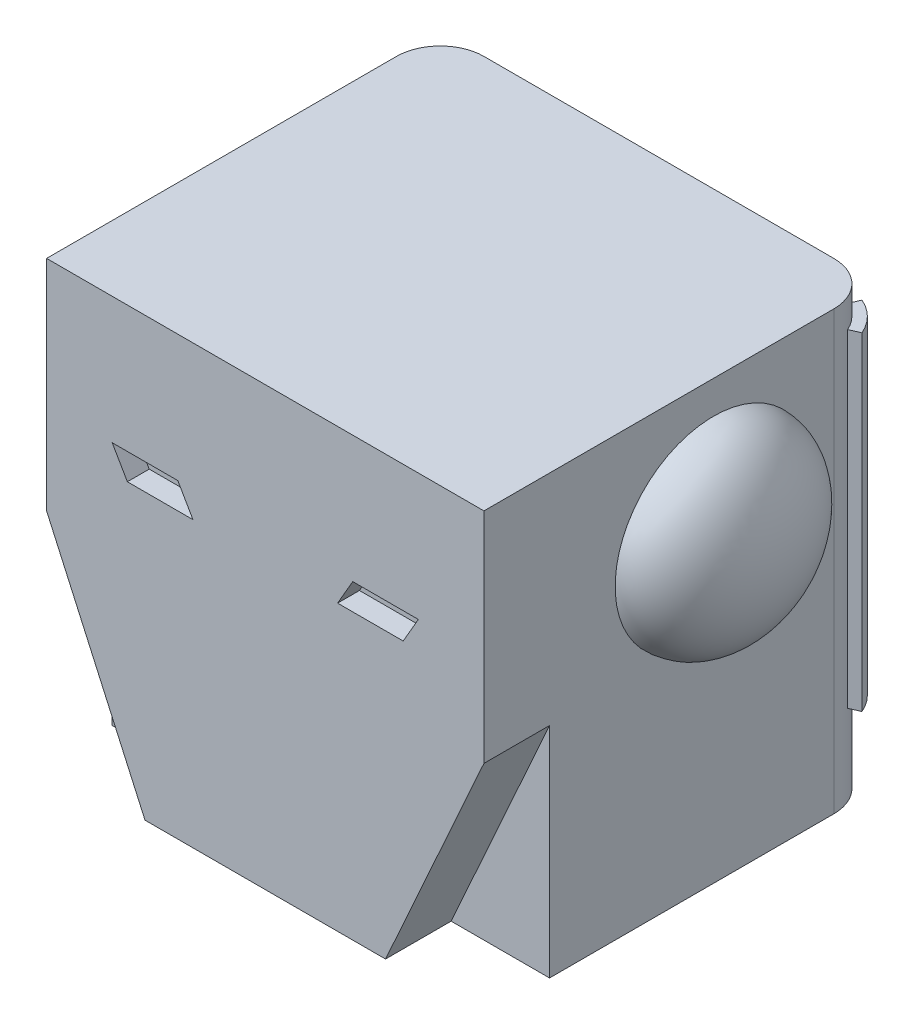
from build123d import *

# Parameters (mm, degrees)
SKETCH1_W           = 20
SKETCH1_H           = 15
BOSS_EXTRUDE1_DEPTH = 20
SKETCH2_R           = 4.5
CUT_EXTRUDE1_DEPTH  = 7
BOSS_EXTRUDE2_DEPTH = 3
CUT_EXTRUDE4_DEPTH  = 1
FILLET1_R           = 2
WRAP1_SECTION_W     = 0.5
WRAP1_SECTION_H     = 15
WRAP1_ANGLE         = 42.971834635


# Read off the part's stored shape, not the designer's step: Dome1
with BuildPart() as part:
    # Sketch1 → Boss-Extrude1 (new body)
    with BuildSketch(Plane(origin=(0, 0, 0), x_dir=(1, 0, 0), z_dir=(0, 1, 0))):
        Rectangle(SKETCH1_W, SKETCH1_H)
    extrude(amount=BOSS_EXTRUDE1_DEPTH)

    # Sketch2 → Cut-Extrude1 (cut)
    with BuildSketch(Plane.XZ):
        with Locations(Location((0, 0, 0), (0, 0, 270))):
            Circle(SKETCH2_R)
    extrude(amount=-CUT_EXTRUDE1_DEPTH, mode=Mode.SUBTRACT)

    # Sketch3 → Boss-Extrude2 (add)
    with BuildSketch(Plane.XY.offset(7.5)):
        Polygon((-10, 20), (-10, 10), (-5.5, 0), (5.5, 0), (10, 10), (10, 20), align=None)
    extrude(amount=BOSS_EXTRUDE2_DEPTH)

    # Sketch5 → Cut-Extrude4 (cut)
    with BuildSketch(Plane.XY.offset(10.5)):
        Polygon((-7, 14.2), (-4, 14.2), (-3.307179677, 13), (-6.307179677, 13), align=None)
    cut_extrude4 = extrude(amount=-CUT_EXTRUDE4_DEPTH, mode=Mode.SUBTRACT)

    # Mirror2: Cut-Extrude4 across plane
    add(cut_extrude4.mirror(Plane(origin=(0, 0, 0), x_dir=(0, 0, 1), z_dir=(1, 0, 0))), mode=Mode.SUBTRACT)

    # Dome1 outline → Dome1 (revolve)
    with BuildSketch(Plane(origin=(0, 14, 0), x_dir=(0, 1, 0), z_dir=(0, 0, -1))):
        with BuildLine():
            Line((0, -9.9999999), (0, -13))
            add(Edge.make_bspline(
                [(0, -13), (4.5, -13), (4.5, -10)],
                knots=[4.71238898, 4.71238898, 4.71238898, 6.283185307, 6.283185307, 6.283185307], degree=2, weights=[1, 0.707106781, 1]))
            Line((4.5, -10), (0, -9.9999999))
        make_face()
    dome1 = revolve(axis=Axis((0, 14, 0), (1, 0, 0)))

    # Mirror7: Dome1 across plane
    add(dome1.mirror(Plane(origin=(0, 0, 0), x_dir=(0, 0, 1), z_dir=(1, 0, 0))))

    # Fillet1
    fillet1_edges = [part.edges().sort_by_distance(p)[0] for p in [
        (-10, 10, -7.5),
        (10, 10, -7.5),
    ]]
    fillet(fillet1_edges, radius=FILLET1_R)

    # Wrap1 section (on wrap section) → Wrap1 (revolve)
    with BuildSketch(Plane(origin=(8, 0, -5.5), x_dir=(0.9169620384790573, 0, -0.39897446032087286), z_dir=(0.39897446032087286, 0, 0.9169620384790573))):
        with Locations((2.25, 11.2)):
            Rectangle(WRAP1_SECTION_W, WRAP1_SECTION_H)
    wrap1 = revolve(axis=Axis((8, 0, -5.5), (0, 1, 0)), revolution_arc=WRAP1_ANGLE)

    # Mirror9: Wrap1 across plane
    add(wrap1.mirror(Plane(origin=(0, 0, 0), x_dir=(0, 0, 1), z_dir=(1, 0, 0))))


solid = part.part
